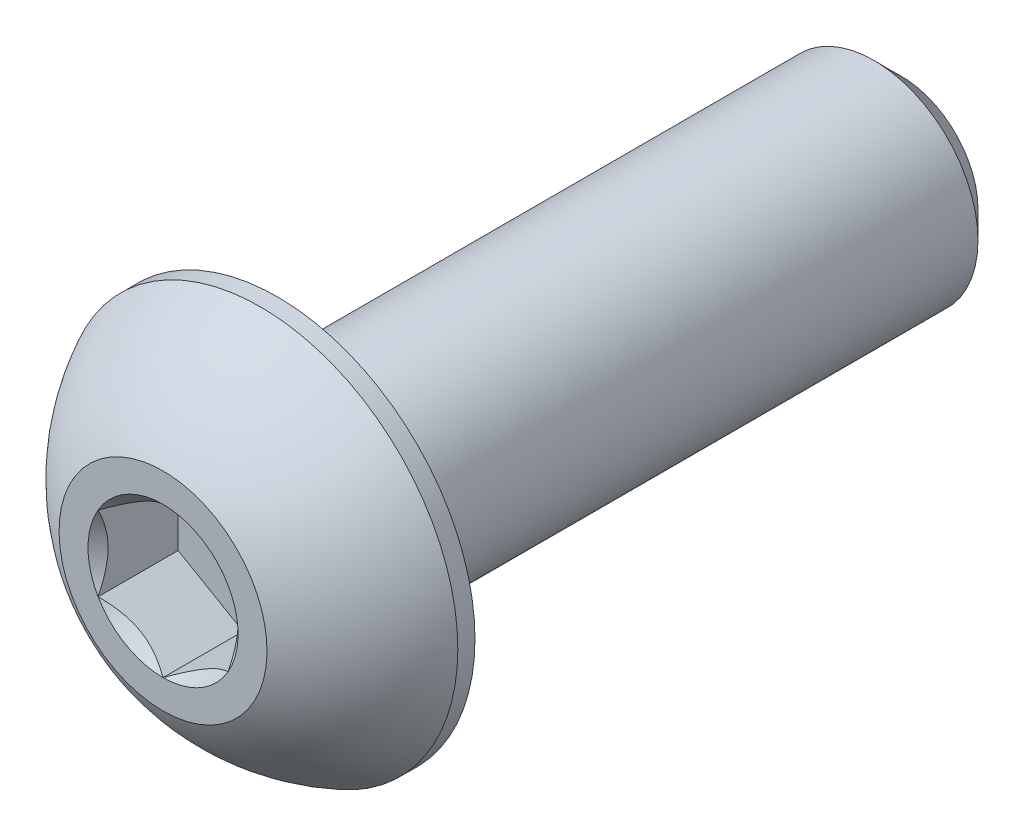
from build123d import *

# Parameters (mm, degrees)
CUT_EXTRUDE2_DEPTH = 1.54


with BuildPart() as part:
    # Sketch10 → Revolve3 (revolve)
    with BuildSketch(Plane(origin=(0, 0, 0), x_dir=(0, 0, -1), z_dir=(1, 0, 0)), mode=Mode.PRIVATE) as revolve3_sk:
        Polygon((13.675, 2), (14.2, 1.475), (14.2, 0), (2.2, 0), (2.2, 2), align=None)
    revolve(revolve3_sk.sketch.rotate(Axis((0, 0, 0), (0, 0, -1)), 90), axis=Axis((0, 0, 0), (0, 0, -1)))

    # Sketch7 → Revolve2 (revolve)
    with BuildSketch(Plane(origin=(0, 0, 0), x_dir=(0, 0, -1), z_dir=(1, 0, 0)), mode=Mode.PRIVATE) as revolve2_sk:
        with BuildLine():
            Line((1.87, 3.8), (2.2, 3.8))
            Line((2.2, 3.8), (2.2, 0))
            Line((2.2, 0), (0, 0))
            Line((0, 0), (0, 2))
            ThreePointArc((0, 2), (0.793500147, 3.047002626), (1.87, 3.8))
        make_face()
    revolve(revolve2_sk.sketch.rotate(Axis((0, 0, 0), (0, 0, -1)), 180), axis=Axis((0, 0, 0), (0, 0, -1)))

    # Sketch5 → Cut-Extrude2 (cut)
    with BuildSketch(Plane.XY):
        Polygon((1.25, -0.721687836), (1.25, 0.721687836), (0, 1.443375673), (-1.25, 0.721687836), (-1.25, -0.721687836), (0, -1.443375673), align=None)
    extrude(amount=-CUT_EXTRUDE2_DEPTH, mode=Mode.SUBTRACT)

    # Cut-Extrude3 cone 1 section (through the dimple's axis) → Cut-Extrude3 (revolve, cut)
    with BuildSketch(Plane(origin=(0, 0, 0), x_dir=(0, -1, 0), z_dir=(1, 0, 0))):
        Polygon((0, 0), (1.443375673, 0), (0, 1.443375673), align=None)
    revolve(axis=Axis((0, 0, 0), (0, 0, -1)), mode=Mode.SUBTRACT)


with BuildPart() as body_2:
    # Split1: read off the stored shape, not the designer's step
    # Split1: the piece on the far side of the plane
    add(part.part)
    split(bisect_by=Plane.XY.offset(-2.2), keep=Keep.BOTTOM)


with BuildPart() as part_1:
    add(part.part)

    # Split1
    split(bisect_by=Plane.XY.offset(-2.2), keep=Keep.TOP)


with BuildPart() as body_2_1:
    add(body_2.part)

    # Boss-Extrude1: read off the stored shape, not the designer's step
    # Boss-Extrude1: union part
    add(part_1.part)


solid = body_2_1.part
